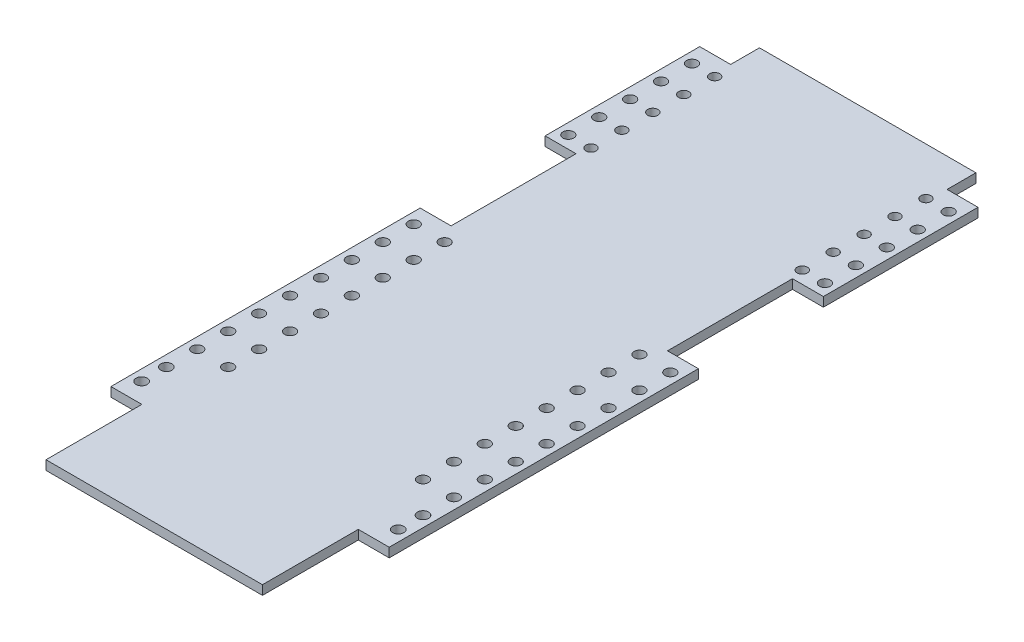
from build123d import *

# Parameters (mm, degrees)
BOSS_EXTRUDE5_DEPTH  = 3
M3_CLEARANCE_HOLE1_D = 3.6
SKETCH8_R            = 1.75
CUT_EXTRUDE1_DEPTH   = 249.962542564
SKETCH10_W           = 10
SKETCH10_H           = 50
SKETCH10_R           = 1.75
BOSS_EXTRUDE6_DEPTH  = 3
SKETCH11_R           = 1.65
CUT_EXTRUDE2_DEPTH   = 249.962542564
SKETCH12_W           = 70
SKETCH12_H           = 5
CUT_EXTRUDE3_DEPTH   = 10


with BuildPart() as part:
    # Sketch5 → Boss-Extrude5 (new body)
    with BuildSketch(Plane(origin=(0, 0, 0), x_dir=(1, 0, 0), z_dir=(0, 1, 0))):
        Polygon((80, 136), (70, 136), (70, 235.74), (0, 235.74), (0, 136), (-10, 136), (-10, 36), (0, 36), (0, 0), (70, 0), (70, 36), (80, 36), align=None)
    extrude(amount=BOSS_EXTRUDE5_DEPTH)

    # M3 Clearance Hole1 (through all)
    with Locations(Plane(origin=(0, 3, 0), x_dir=(1, 0, 0), z_dir=(0, 1, 0))):
        with Locations((76.5, 50.42), (76.5, 42.42)):
            m3_clearance_hole1 = Hole(M3_CLEARANCE_HOLE1_D / 2)

    # Sketch8 → Cut-Extrude1 (cut, through all)
    with BuildSketch(Plane(origin=(0, 3, 0), x_dir=(1, 0, 0), z_dir=(0, 1, 0))):
        with Locations((76.5, 60.42)):
            Circle(SKETCH8_R)
        with Locations((66.5, 60.42)):
            Circle(SKETCH8_R)
        with Locations((66.5, 70.42)):
            Circle(SKETCH8_R)
        with Locations((66.5, 80.42)):
            Circle(SKETCH8_R)
        with Locations((66.5, 90.42)):
            Circle(SKETCH8_R)
        with Locations((66.5, 100.42)):
            Circle(SKETCH8_R)
        with Locations((66.5, 110.42)):
            Circle(SKETCH8_R)
        with Locations((66.5, 120.42)):
            Circle(SKETCH8_R)
        with Locations((66.5, 130.42)):
            Circle(SKETCH8_R)
        with Locations((76.5, 70.42)):
            Circle(SKETCH8_R)
        with Locations((76.5, 80.42)):
            Circle(SKETCH8_R)
        with Locations((76.5, 90.42)):
            Circle(SKETCH8_R)
        with Locations((76.5, 100.42)):
            Circle(SKETCH8_R)
        with Locations((76.5, 110.42)):
            Circle(SKETCH8_R)
        with Locations((76.5, 120.42)):
            Circle(SKETCH8_R)
        with Locations((76.5, 130.42)):
            Circle(SKETCH8_R)
    cut_extrude1 = extrude(amount=-CUT_EXTRUDE1_DEPTH, mode=Mode.SUBTRACT)

    # Sketch10 → Boss-Extrude6 (add)
    with BuildSketch(Plane.XZ):
        with Locations((75, -201.42)):
            Rectangle(SKETCH10_W, SKETCH10_H)
        with Locations((76.5, -180.42)):
            Circle(SKETCH10_R, mode=Mode.SUBTRACT)
        with Locations((76.5, -190.42)):
            Circle(SKETCH10_R, mode=Mode.SUBTRACT)
        with Locations((76.5, -200.42)):
            Circle(SKETCH10_R, mode=Mode.SUBTRACT)
        with Locations((76.5, -210.42)):
            Circle(SKETCH10_R, mode=Mode.SUBTRACT)
        with Locations((76.5, -220.42)):
            Circle(SKETCH10_R, mode=Mode.SUBTRACT)
    boss_extrude6 = extrude(amount=-BOSS_EXTRUDE6_DEPTH)

    # Sketch11 → Cut-Extrude2 (cut, through all)
    with BuildSketch(Plane(origin=(0, 3, 0), x_dir=(1, 0, 0), z_dir=(0, 1, 0))):
        with Locations((69.165215785, 180.420635549)):
            Circle(SKETCH11_R)
        with Locations((69.165215785, 190.420635549)):
            Circle(SKETCH11_R)
        with Locations((69.165215785, 200.420635549)):
            Circle(SKETCH11_R)
        with Locations((69.165215785, 210.420635549)):
            Circle(SKETCH11_R)
        with Locations((69.165215785, 220.420635549)):
            Circle(SKETCH11_R)
    cut_extrude2 = extrude(amount=-CUT_EXTRUDE2_DEPTH, mode=Mode.SUBTRACT)

    # Mirror1: M3 Clearance Hole1, Cut-Extrude1, Boss-Extrude6, Cut-Extrude2 across plane
    add(m3_clearance_hole1.mirror(Plane.ZY.offset(-35)), mode=Mode.SUBTRACT)
    add(cut_extrude1.mirror(Plane.ZY.offset(-35)), mode=Mode.SUBTRACT)
    add(boss_extrude6.mirror(Plane.ZY.offset(-35)))
    add(cut_extrude2.mirror(Plane.ZY.offset(-35)), mode=Mode.SUBTRACT)

    # Sketch12 → Cut-Extrude3 (cut)
    with BuildSketch(Plane(origin=(0, 3, 0), x_dir=(1, 0, 0), z_dir=(0, 1, 0))):
        with Locations((35, 2.5)):
            Rectangle(SKETCH12_W, SKETCH12_H)
    extrude(amount=-CUT_EXTRUDE3_DEPTH, mode=Mode.SUBTRACT)


solid = part.part
